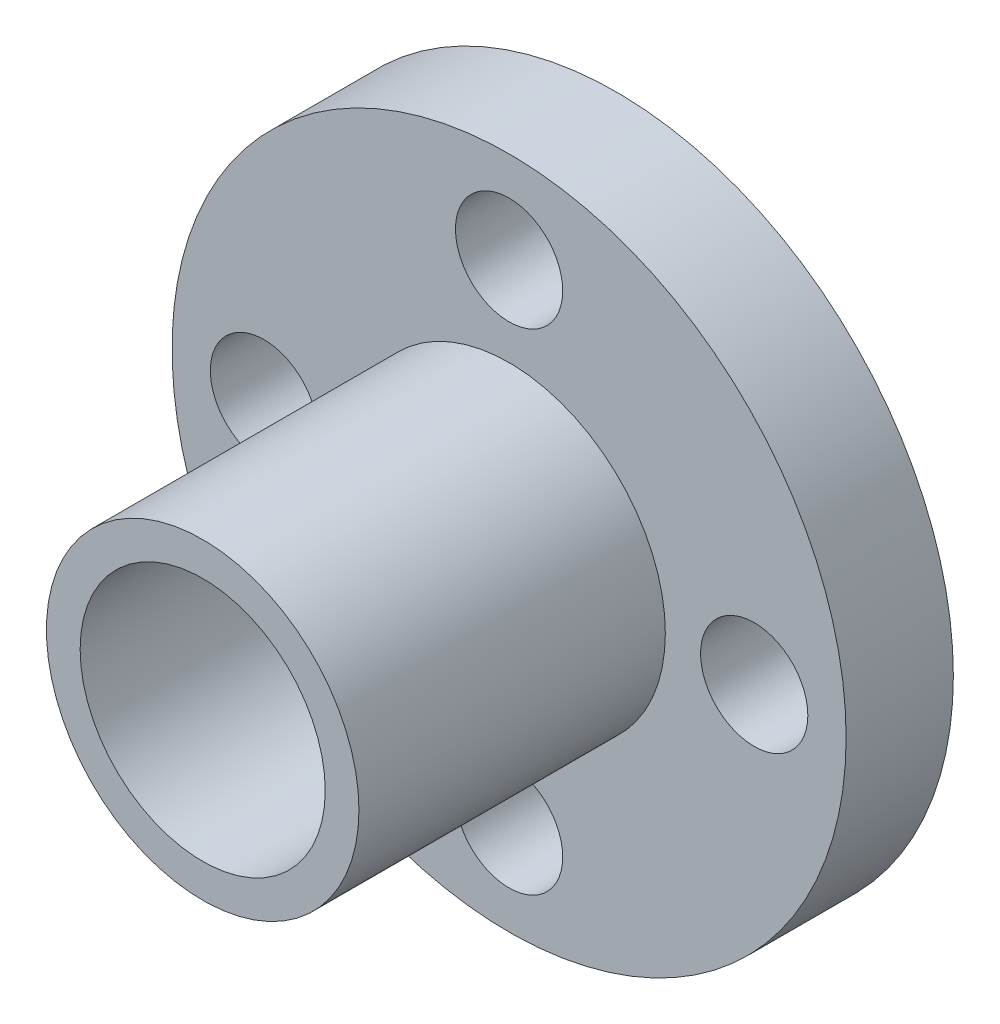
from build123d import *

# Parameters (mm, degrees)
SKETCH1_R           = 5.1
SKETCH1_R_2         = 4
BOSS_EXTRUDE1_DEPTH = 15
BOSS_EXTRUDE2_START = 1.5
SKETCH1_3_R         = 11
SKETCH1_3_R_2       = 5.1
BOSS_EXTRUDE2_DEPTH = 3.5
SKETCH2_R           = 1.75
CUT_EXTRUDE1_DEPTH  = 19.493242009


with BuildPart() as part:
    # Sketch1 → Boss-Extrude1 (new body)
    with BuildSketch(Plane.XY):
        Circle(SKETCH1_R)
        Circle(SKETCH1_R_2, mode=Mode.SUBTRACT)
    extrude(amount=BOSS_EXTRUDE1_DEPTH)

    # Sketch1<3> → Boss-Extrude2 (add)
    with BuildSketch(Plane.XY.offset(BOSS_EXTRUDE2_START)):
        Circle(SKETCH1_3_R)
        Circle(SKETCH1_3_R_2, mode=Mode.SUBTRACT)
    extrude(amount=BOSS_EXTRUDE2_DEPTH)

    # Sketch2 → Cut-Extrude1 (cut, through all)
    with BuildSketch(Plane.XY.offset(5)):
        with Locations((8, 0)):
            Circle(SKETCH2_R)
        with Locations((0, -8)):
            Circle(SKETCH2_R)
        with Locations((-8, 0)):
            Circle(SKETCH2_R)
        with Locations((0, 8)):
            Circle(SKETCH2_R)
    extrude(amount=-CUT_EXTRUDE1_DEPTH, mode=Mode.SUBTRACT)


solid = part.part
